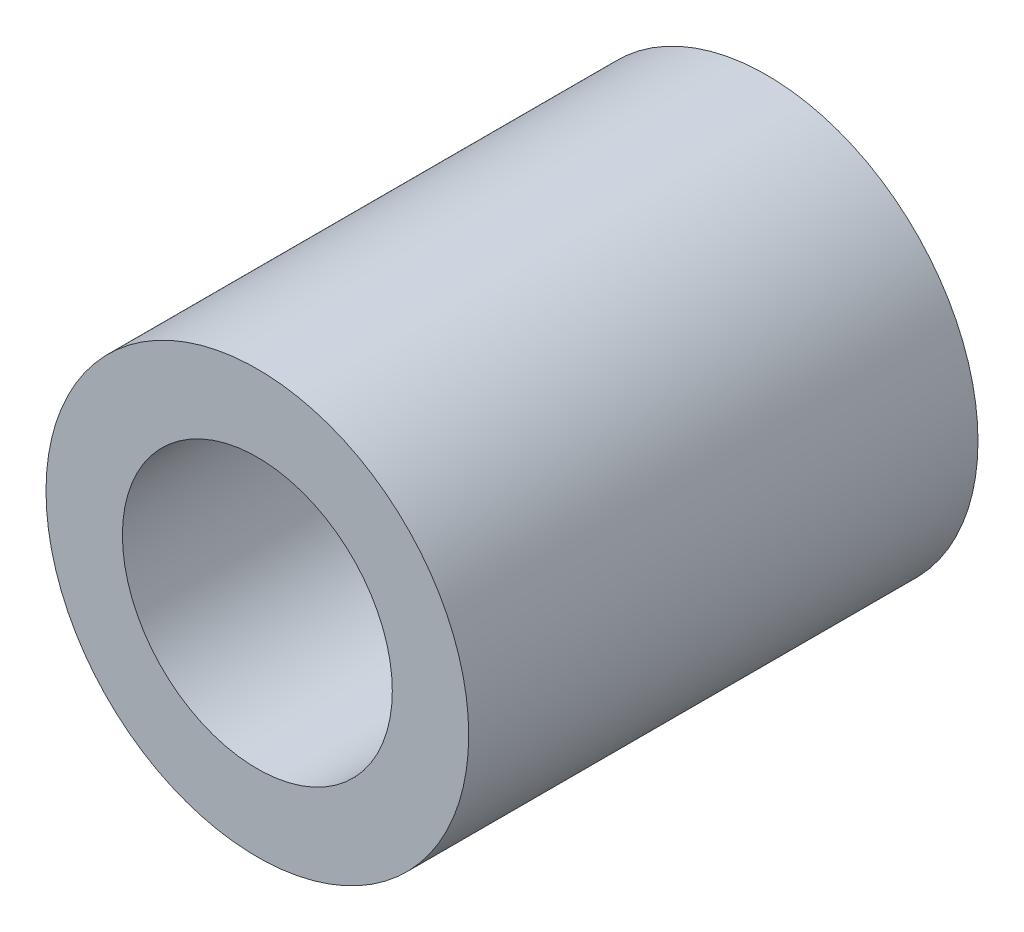
from build123d import *

# Parameters (mm, degrees)
SKETCH1_R           = 4.15
SKETCH1_R_2         = 2.65
BOSS_EXTRUDE1_DEPTH = 10


with BuildPart() as part:
    # Sketch1 → Boss-Extrude1 (new body)
    with BuildSketch(Plane.XY):
        Circle(SKETCH1_R)
        Circle(SKETCH1_R_2, mode=Mode.SUBTRACT)
    extrude(amount=BOSS_EXTRUDE1_DEPTH)


solid = part.part
